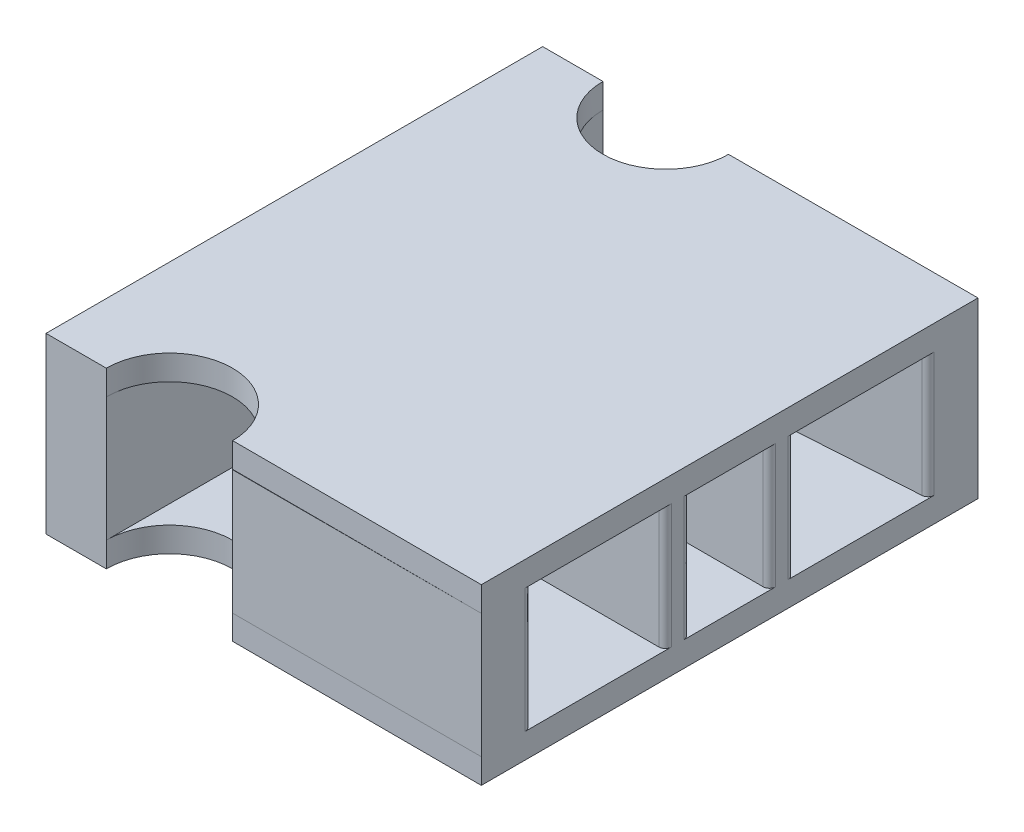
from build123d import *

# Parameters (mm, degrees)
SALIENTE_EXTRUIR1_DEPTH   = 5
SALIENTE_EXTRUIR1_2_DEPTH = 5
CROQUIS1_W                = 4.860345515
CROQUIS1_H                = 40
SALIENTE_EXTRUIR1_3_DEPTH = 5
SALIENTE_EXTRUIR2_DEPTH   = 2
REDONDEO1_R               = 0.5
REDONDEO2_R               = 0.5
REDONDEO3_R               = 0.5
CROQUIS5_W                = 30.200510783
CROQUIS5_H                = 2
SALIENTE_EXTRUIR3_DEPTH   = 5
REDONDEO4_R               = 0.5


with BuildPart() as part:
    # Croquis1 → Saliente-Extruir1 (new, symmetric)
    with BuildSketch(Plane(origin=(0, 0, 0), x_dir=(1, 0, 0), z_dir=(0, 1, 0))):
        Polygon((17.530428149, 19.999144472), (-2.49913463, 19.999144472), (-2.53039772, 19.968072403), (-2.53039772, 14.718192691), (17.530428149, 16.000273752), align=None)
    extrude(amount=SALIENTE_EXTRUIR1_DEPTH, both=True)



with BuildPart() as body_2:
    # Croquis1 → Saliente-Extruir1 2 (new, symmetric)
    with BuildSketch(Plane(origin=(0, 0, 0), x_dir=(1, 0, 0), z_dir=(0, 1, 0))):
        Polygon((17.530428149, -20.000855528), (-2.49913463, -20.000855528), (-2.530548466, -19.969634553), (-2.530548466, -14.710829577), (17.530428149, -15.997364244), align=None)
    extrude(amount=SALIENTE_EXTRUIR1_2_DEPTH, both=True)


with BuildPart() as body_3:
    # Croquis1 → Saliente-Extruir1 3 (new, symmetric)
    with BuildSketch(Plane(origin=(0, 0, 0), x_dir=(1, 0, 0), z_dir=(0, 1, 0))):
        with Locations((-15.100255392, -0.000855528)):
            Rectangle(CROQUIS1_W, CROQUIS1_H)
    extrude(amount=SALIENTE_EXTRUIR1_3_DEPTH, both=True)


with BuildPart() as part_1:
    add(part.part)

    add(body_2.part)  # Saliente-Extruir2 merges body 2

    add(body_3.part)  # Saliente-Extruir2 merges body 3
    # Croquis3 → Saliente-Extruir2 (add)
    with BuildSketch(Plane(origin=(0, 5, 0), x_dir=(1, 0, 0), z_dir=(0, 1, 0))):
        with BuildLine():
            Line((-17.530428149, 19.999144472), (-12.670082634, 19.999144472))
            ThreePointArc((-12.670082634, 19.999144472), (-7.615776211, 14.91376598), (-2.53039772, 19.968072403))
            Line((-2.53039772, 19.968072403), (17.530428149, 19.999144472))
            Line((17.530428149, 19.999144472), (17.530428149, -20.000855528))
            Line((17.530428149, -20.000855528), (-2.530548466, -19.969634553))
            ThreePointArc((-2.530548466, -19.969634553), (-7.615926037, -14.915477956), (-12.670082634, -20.000855528))
            Line((-12.670082634, -20.000855528), (-17.530428149, -20.000855528))
            Line((-17.530428149, -20.000855528), (-17.530428149, 19.999144472))
        make_face()
    saliente_extruir2 = extrude(amount=SALIENTE_EXTRUIR2_DEPTH)

    # Simetría1: Saliente-Extruir2 across plane
    add(saliente_extruir2.mirror(Plane.ZX))

    # Redondeo1
    redondeo1_edges = [part_1.edges().sort_by_distance(p)[0] for p in [
        (-2.530548466, 0, 14.710829577),
    ]]
    fillet(redondeo1_edges, radius=REDONDEO1_R)

    # Redondeo2
    redondeo2_edges = [part_1.edges().sort_by_distance(p)[0] for p in [
        (-2.53039772, 0, -14.718192691),
    ]]
    fillet(redondeo2_edges, radius=REDONDEO2_R)

    # Redondeo3
    redondeo3_edges = [part_1.edges().sort_by_distance(p)[0] for p in [
        (17.530428149, 0, -16.000273752),
        (17.530428149, 0, 15.997364244),
    ]]
    fillet(redondeo3_edges, radius=REDONDEO3_R)

    # Croquis5 → Saliente-Extruir3 (add, symmetric)
    with BuildSketch(Plane(origin=(0, 0, 0), x_dir=(1, 0, 0), z_dir=(0, 1, 0))):
        with Locations((2.430172758, -4.198493404)):
            Rectangle(CROQUIS5_W, CROQUIS5_H)
        with Locations((2.430172758, 4.201506596)):
            Rectangle(CROQUIS5_W, CROQUIS5_H)
    extrude(amount=SALIENTE_EXTRUIR3_DEPTH, both=True)

    # Redondeo4
    redondeo4_edges = [part_1.edges().sort_by_distance(p)[0] for p in [
        (17.530428149, 0, -5.201506596),
        (17.530428149, 0, -3.201506596),
        (17.530428149, 0, 3.198493404),
        (17.530428149, 0, 5.198493404),
    ]]
    fillet(redondeo4_edges, radius=REDONDEO4_R)


solid = part_1.part
